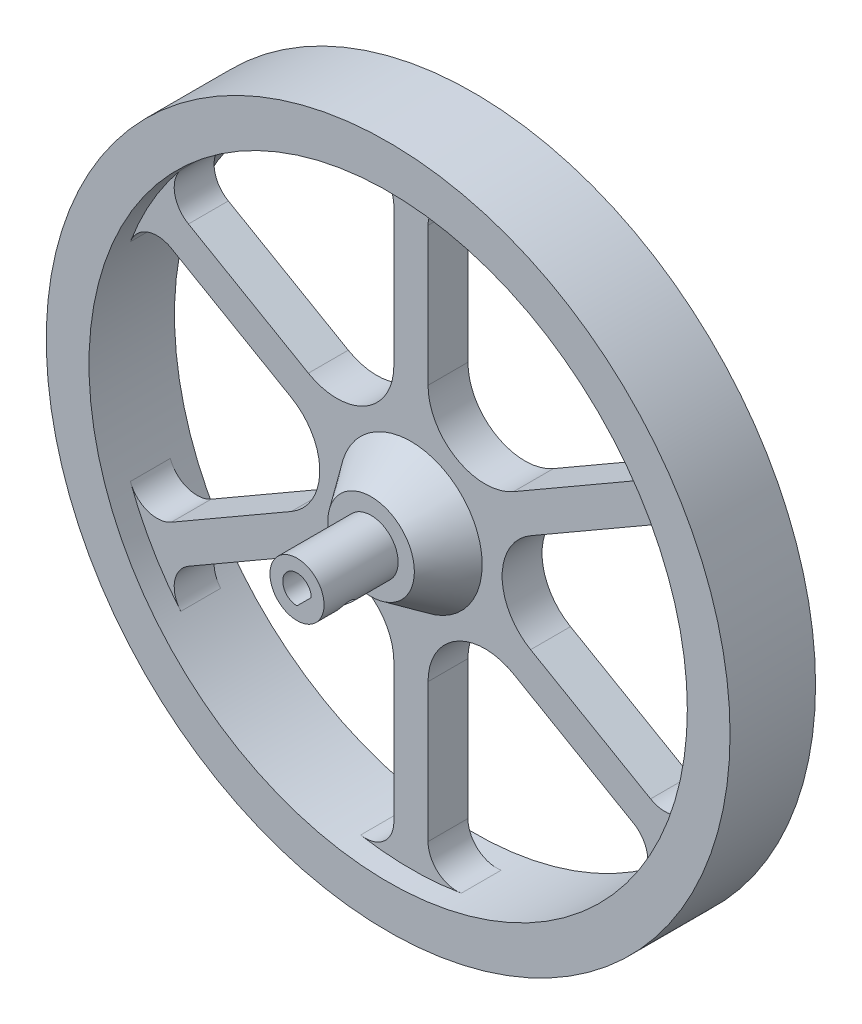
from build123d import *
from build123d.topology import SkipClean

# Parameters (mm, degrees)
CROQUIS1_R                 = 60
SALIENTE_EXTRUIR1_DEPTH    = 7.5
CROQUIS2_R                 = 52.5
CORTAR_EXTRUIR1_DEPTH      = 4
CROQUIS4_R                 = 4.75
SALIENTE_EXTRUIR2_DEPTH    = 20
CROQUIS6_R                 = 12.5
SALIENTE_EXTRUIR3_DEPTH    = 7
SALIENTE_EXTRUIR3_TAPER    = 35
CORTAR_EXTRUIR3_DEPTH      = 20
CORTAR_EXTRUIR4_REACH      = 91.752
CORTAR_EXTRUIR4_END_RADIUS = 4.75
CROQUIS7_R                 = 1.5
CORTAR_EXTRUIR5_START      = -7
CORTAR_EXTRUIR5_DEPTH      = 7
CORTAR_EXTRUIR6_DEPTH      = 3


# Read off the part's stored shape, not the designer's step: Cortar-Extruir5
with BuildPart() as part:
    # Croquis1 → Saliente-Extruir1 (new, symmetric)
    with BuildSketch(Plane.XY):
        Circle(CROQUIS1_R)
    extrude(amount=SALIENTE_EXTRUIR1_DEPTH, both=True)

    # Croquis2 → Cortar-Extruir1 (cut)
    with BuildSketch(Plane.XY.offset(7.5)):
        Circle(CROQUIS2_R)
    cortar_extruir1 = extrude(amount=-CORTAR_EXTRUIR1_DEPTH, mode=Mode.SUBTRACT)

    # Simetría1: Cortar-Extruir1 across plane
    add(cortar_extruir1.mirror(Plane.XY), mode=Mode.SUBTRACT)

    # Croquis4 → Saliente-Extruir2 (add)
    with BuildSketch(Plane.XY.offset(3.5)):
        Circle(CROQUIS4_R)
    extrude(amount=SALIENTE_EXTRUIR2_DEPTH)

    # Croquis6 → Saliente-Extruir3 (add)
    with BuildSketch(Plane.XY.offset(3.5)):
        Circle(CROQUIS6_R)
    extrude(amount=SALIENTE_EXTRUIR3_DEPTH, taper=SALIENTE_EXTRUIR3_TAPER)

    # Croquis5 → Cortar-Extruir3 (cut)
    with BuildSketch(Plane.XY.offset(23.5)):
        with BuildLine():
            Line((2.5, 0), (0, -2.5))
            ThreePointArc((0, -2.5), (-1.767766953, 1.767766953), (2.5, 0))
        make_face()
    extrude(amount=-CORTAR_EXTRUIR3_DEPTH, mode=Mode.SUBTRACT)

    # Cortar-Extruir4: up to this cylinder (the profile starts inside it)
    cortar_extruir4_end = Plane(origin=(0, 0, 18.5), z_dir=(0, 0, -1)) * Cylinder(CORTAR_EXTRUIR4_END_RADIUS, 194.004, mode=Mode.PRIVATE)
    # Croquis7 → Cortar-Extruir4 (cut, up to the surface)
    with BuildSketch(Plane(origin=(1.25, -1.25, 0), x_dir=(0, 0, 1), z_dir=(-0.7071067811865477, 0.7071067811865475, 0)), mode=Mode.PRIVATE) as cortar_extruir4_sk1:
        with Locations(Location((18.5, 0, 0), (0, 0, 270))):
            Circle(CROQUIS7_R)
    cortar_extruir4_tool1 = extrude(cortar_extruir4_sk1.sketch, amount=-CORTAR_EXTRUIR4_REACH, mode=Mode.PRIVATE) & cortar_extruir4_end
    add(cortar_extruir4_tool1.solids().sort_by_distance((1.25, -1.25, 18.5))[0], mode=Mode.SUBTRACT)

    # Cortar-Extruir5 outline → Cortar-Extruir5 (cut)
    with SkipClean():  # the faces are left unmerged after this step: merging them gives an invalid solid
        with BuildSketch(Plane.XY.offset(3.5).offset(CORTAR_EXTRUIR5_START)):
            with BuildLine():
                ThreePointArc((49.237906391, -18.217534801), (52.5, 0), (49.237906391, 18.217534801))
                ThreePointArc((49.237906391, 18.217534801), (46.246213297, 21.185514358), (42.048581973, 20.812658506))
                Line((42.048581973, 20.812658506), (21, 8.660254038))
                ThreePointArc((21, 8.660254038), (16, 0), (21, -8.660254038))
                Line((21, -8.660254038), (42.048581973, -20.812658506))
                ThreePointArc((42.048581973, -20.812658506), (46.246213297, -21.185514358), (49.237906391, -18.217534801))
            make_face()
            with BuildLine():
                ThreePointArc((39.048581973, 26.008810929), (41.470300275, 29.457638365), (40.395801128, 33.532510363))
                ThreePointArc((40.395801128, 33.532510363), (26.25, 45.466333699), (8.842105263, 51.750045164))
                ThreePointArc((8.842105263, 51.750045164), (4.775913022, 50.643152723), (3, 46.821469434))
                Line((3, 46.821469434), (3, 22.516660498))
                ThreePointArc((3, 22.516660498), (8, 13.856406461), (18, 13.856406461))
                Line((18, 13.856406461), (39.048581973, 26.008810929))
            make_face()
            with BuildLine():
                ThreePointArc((8.842105263, -51.750045164), (26.25, -45.466333699), (40.395801128, -33.532510363))
                ThreePointArc((40.395801128, -33.532510363), (41.470300275, -29.457638365), (39.048581973, -26.008810929))
                Line((39.048581973, -26.008810929), (18, -13.856406461))
                ThreePointArc((18, -13.856406461), (8, -13.856406461), (3, -22.516660498))
                Line((3, -22.516660498), (3, -46.821469434))
                ThreePointArc((3, -46.821469434), (4.775913022, -50.643152723), (8.842105263, -51.750045164))
            make_face()
            with BuildLine():
                ThreePointArc((-3, 46.821469434), (-4.775913022, 50.643152723), (-8.842105263, 51.750045164))
                ThreePointArc((-8.842105263, 51.750045164), (-26.25, 45.466333699), (-40.395801128, 33.532510363))
                ThreePointArc((-40.395801128, 33.532510363), (-41.470300275, 29.457638365), (-39.048581973, 26.008810929))
                Line((-39.048581973, 26.008810929), (-18, 13.856406461))
                ThreePointArc((-18, 13.856406461), (-8, 13.856406461), (-3, 22.516660498))
                Line((-3, 22.516660498), (-3, 46.821469434))
            make_face()
            with BuildLine():
                ThreePointArc((-40.395801128, -33.532510363), (-26.25, -45.466333699), (-8.842105263, -51.750045164))
                ThreePointArc((-8.842105263, -51.750045164), (-4.775913022, -50.643152723), (-3, -46.821469434))
                Line((-3, -46.821469434), (-3, -22.516660498))
                ThreePointArc((-3, -22.516660498), (-8, -13.856406461), (-18, -13.856406461))
                Line((-18, -13.856406461), (-39.048581973, -26.008810929))
                ThreePointArc((-39.048581973, -26.008810929), (-41.470300275, -29.457638365), (-40.395801128, -33.532510363))
            make_face()
            with BuildLine():
                ThreePointArc((-42.048581973, 20.812658506), (-46.246213297, 21.185514358), (-49.237906391, 18.217534801))
                ThreePointArc((-49.237906391, 18.217534801), (-52.5, 0), (-49.237906391, -18.217534801))
                ThreePointArc((-49.237906391, -18.217534801), (-46.246213297, -21.185514358), (-42.048581973, -20.812658506))
                Line((-42.048581973, -20.812658506), (-21, -8.660254038))
                ThreePointArc((-21, -8.660254038), (-16, 0), (-21, 8.660254038))
                Line((-21, 8.660254038), (-42.048581973, 20.812658506))
            make_face()
        extrude(amount=CORTAR_EXTRUIR5_DEPTH, mode=Mode.SUBTRACT)
    add(part.part.scale(1), mode=Mode.REPLACE)  # the faces are merged on a copy

    # Croquis10 → Cortar-Extruir6 (cut)
    # profile 1 of 3: a face of its own
    with BuildSketch(Plane(origin=(0, 0, -3.5), x_dir=(-1, 0, 0), z_dir=(0, 0, -1))):
        with BuildLine():
            add(Edge.make_bspline(
                [(-8.618636529, -3.958585729), (-8.626034443, -3.969769874), (-8.63979748, -3.990576788), (-8.636380298, -4.031184404), (-8.605950842, -4.063150051), (-8.558290764, -4.089833553), (-8.491226427, -4.116129017), (-8.402473137, -4.138086281), (-8.293065323, -4.160143533), (-8.162351503, -4.178091981), (-8.011060276, -4.196215959), (-7.838518307, -4.20980545), (-7.64473259, -4.223491848), (-7.429842437, -4.233399867), (-7.193977464, -4.240148474), (-6.937171289, -4.24652816), (-6.658847945, -4.248847202), (-6.465989654, -4.249648627), (-6.365900736, -4.250064548)],
                knots=[0, 0, 0, 0, 0.264522454, 0.492115977, 0.758469058, 1.116905389, 1.594696211, 2.206856012, 2.960861016, 3.847548454, 4.869807865, 6.037241621, 7.341541194, 8.792334255, 10.380264796, 12.105895113, 13.979051144, 16, 16, 16, 16], degree=3))
            add(Edge.make_bspline(
                [(-6.365900736, -4.250064548), (-6.308104413, -4.247595857), (-6.19996694, -4.242976912), (-6.049776099, -4.207848597), (-5.926348063, -4.143646756), (-5.843800989, -4.065651364), (-5.789760291, -3.983293619), (-5.750141813, -3.898164226), (-5.706113822, -3.792822966), (-5.660719786, -3.664843627), (-5.616516764, -3.514331476), (-5.569667616, -3.34182126), (-5.51939755, -3.147813608), (-5.488598777, -3.010038424), (-5.472422951, -2.937677506)],
                knots=[0, 0, 0, 0, 1.181004775, 2.209671203, 3.12485452, 3.993073648, 4.496817558, 5.130576657, 5.908980013, 6.830669454, 7.904106987, 9.114595617, 10.484556503, 12, 12, 12, 12], degree=3))
            Line((-5.472422951, -2.937677506), (-5.097455225, -2.937677506))
            Line((-5.097455225, -2.937677506), (-5.273221347, -5))
            Line((-5.273221347, -5), (-9.784551802, -5))
            Line((-9.784551802, -5), (-9.784551802, -4.746603841))
            Line((-9.784551802, -4.746603841), (-8.300792792, -3.113443628))
            add(Edge.make_bspline(
                [(-8.300792792, -3.113443628), (-8.202601232, -3.009989162), (-8.016196217, -2.813593144), (-7.752161322, -2.533705689), (-7.519320432, -2.284109648), (-7.318987486, -2.063212191), (-7.146386785, -1.875714908), (-7.008201899, -1.714852876), (-6.896576198, -1.587674969), (-6.836735593, -1.509346824), (-6.811174911, -1.475889261)],
                knots=[0, 0, 0, 0, 1.545890058, 2.934688704, 4.17028174, 5.24526459, 6.166829156, 6.931941195, 7.543782827, 8, 8, 8, 8], degree=3))
            add(Edge.make_bspline(
                [(-6.811174911, -1.475889261), (-6.754997292, -1.397475865), (-6.645845913, -1.245121055), (-6.503438896, -1.011924417), (-6.385002919, -0.782476269), (-6.291593836, -0.557215903), (-6.21963523, -0.339145391), (-6.167905745, -0.13064431), (-6.135070067, 0.067857618), (-6.130721514, 0.197192775), (-6.128616472, 0.25980119)],
                knots=[0, 0, 0, 0, 1.221342228, 2.373030247, 3.457097868, 4.48831189, 5.458191672, 6.362523757, 7.207332364, 8, 8, 8, 8], degree=3))
            add(Edge.make_bspline(
                [(-6.128616472, 0.25980119), (-6.12994016, 0.309145796), (-6.132514799, 0.405123517), (-6.146767524, 0.545367205), (-6.172630682, 0.677514679), (-6.211492788, 0.800599348), (-6.257885143, 0.916619927), (-6.317251131, 1.02369836), (-6.38587227, 1.123781877), (-6.465590562, 1.215080622), (-6.554391837, 1.296769797), (-6.652261062, 1.367937753), (-6.75814723, 1.427734861), (-6.871626773, 1.478306947), (-6.994063966, 1.516339364), (-7.124747398, 1.541906761), (-7.263348981, 1.558544639), (-7.358441029, 1.560784168), (-7.407315007, 1.561935207)],
                knots=[0, 0, 0, 0, 1.144811332, 2.226715166, 3.266231702, 4.262137236, 5.217010938, 6.159784736, 7.096004777, 8.02721036, 8.965073134, 9.889365439, 10.827775152, 11.781102716, 12.766194483, 13.794607472, 14.866505594, 16, 16, 16, 16], degree=3))
            add(Edge.make_bspline(
                [(-7.407315007, 1.561935207), (-7.462532456, 1.561390595), (-7.570778448, 1.560322959), (-7.728751599, 1.543199133), (-7.878901161, 1.518378731), (-8.021963245, 1.485613944), (-8.156283293, 1.439606465), (-8.283502646, 1.385493666), (-8.402725567, 1.320814967), (-8.512315011, 1.246778562), (-8.612048882, 1.167729006), (-8.699502323, 1.086636743), (-8.773834513, 1.003973097), (-8.834666543, 0.920205583), (-8.881621631, 0.835001961), (-8.916971551, 0.748858063), (-8.935704611, 0.660466191), (-8.939162374, 0.601153561), (-8.940874418, 0.571786056)],
                knots=[0, 0, 0, 0, 1.326433612, 2.60028531, 3.813684945, 4.983463278, 6.122649585, 7.221225408, 8.302875734, 9.376861028, 10.395780236, 11.358844163, 12.239770449, 13.063676203, 13.84097391, 14.573117523, 15.293506644, 16, 16, 16, 16], degree=3))
            add(Edge.make_bspline(
                [(-8.940874418, 0.571786056), (-8.939506439, 0.534958047), (-8.937007758, 0.467689892), (-8.899333875, 0.41229768), (-8.882285711, 0.387231628)],
                knots=[0, 0, 0, 0, 1.094961168, 2, 2, 2, 2], degree=3))
            add(Edge.make_bspline(
                [(-8.882285711, 0.387231628), (-8.870945509, 0.376477988), (-8.845270659, 0.352131148), (-8.792658261, 0.324307194), (-8.725508445, 0.298261003), (-8.675402129, 0.282880738), (-8.647930882, 0.274448367)],
                knots=[0, 0, 0, 0, 0.710690112, 1.609041988, 2.689135369, 4, 4, 4, 4], degree=3))
            add(Edge.make_bspline(
                [(-8.647930882, 0.274448367), (-8.611921151, 0.264281261), (-8.54245406, 0.244667695), (-8.448231847, 0.199291045), (-8.368856918, 0.142416004), (-8.302431238, 0.075937268), (-8.252735237, -0.003611878), (-8.21505907, -0.092320949), (-8.19512868, -0.192910451), (-8.19237843, -0.263023964), (-8.190938966, -0.299720964)],
                knots=[0, 0, 0, 0, 1.118595343, 2.15790461, 3.111021168, 4.030836712, 4.951116574, 5.901090488, 6.901443123, 8, 8, 8, 8], degree=3))
            add(Edge.make_bspline(
                [(-8.190938966, -0.299720964), (-8.192728697, -0.339506769), (-8.196211743, -0.416935051), (-8.228629236, -0.527134954), (-8.278641104, -0.628283369), (-8.351033461, -0.714659827), (-8.436985817, -0.788486093), (-8.539295003, -0.837552074), (-8.651298462, -0.870249609), (-8.730194856, -0.873615551), (-8.770967167, -0.875355012)],
                knots=[0, 0, 0, 0, 1.041125866, 2.026164562, 2.988296164, 3.980302212, 4.962423256, 5.935991559, 6.933355608, 8, 8, 8, 8], degree=3))
            add(Edge.make_bspline(
                [(-8.770967167, -0.875355012), (-8.818301015, -0.871871804), (-8.913336446, -0.864878327), (-9.049774545, -0.81038197), (-9.175690901, -0.721736715), (-9.28962821, -0.602057999), (-9.38687557, -0.455065452), (-9.452935144, -0.282419314), (-9.497615301, -0.091555703), (-9.50137215, 0.04323017), (-9.503326007, 0.113329422)],
                knots=[0, 0, 0, 0, 0.83205251, 1.670569209, 2.548472486, 3.527734868, 4.565379759, 5.630600578, 6.767725999, 8, 8, 8, 8], degree=3))
            add(Edge.make_bspline(
                [(-9.503326007, 0.113329422), (-9.500257972, 0.194113961), (-9.494195313, 0.353750048), (-9.445066196, 0.587225746), (-9.36095501, 0.807792403), (-9.248338157, 1.017733248), (-9.100199899, 1.212429926), (-8.918156943, 1.389017025), (-8.702696627, 1.546434694), (-8.4593366, 1.683484438), (-8.194013277, 1.795639347), (-7.915144112, 1.87805181), (-7.625387245, 1.927852209), (-7.428991489, 1.933863403), (-7.32968497, 1.936902934)],
                knots=[0, 0, 0, 0, 0.920453742, 1.818883095, 2.704880925, 3.603999707, 4.525765236, 5.482253031, 6.485303894, 7.559571233, 8.659544837, 9.762092633, 10.86841348, 12, 12, 12, 12], degree=3))
            add(Edge.make_bspline(
                [(-7.32968497, 1.936902934), (-7.231338984, 1.933922927), (-7.037333978, 1.928044333), (-6.752216064, 1.877753341), (-6.478110886, 1.79757811), (-6.219365606, 1.684548515), (-5.980211424, 1.5488039), (-5.768465096, 1.390768229), (-5.590152156, 1.209627257), (-5.445260796, 1.010003867), (-5.331471768, 0.796383909), (-5.25039548, 0.571530012), (-5.20023069, 0.336713611), (-5.194226518, 0.176558111), (-5.191197157, 0.09575281)],
                knots=[0, 0, 0, 0, 1.125553274, 2.220354679, 3.304870239, 4.389270482, 5.446207922, 6.448192551, 7.405024832, 8.34559417, 9.263572082, 10.167392221, 11.075370971, 12, 12, 12, 12], degree=3))
            add(Edge.make_bspline(
                [(-5.191197157, 0.09575281), (-5.193185155, 0.038565599), (-5.197193835, -0.076749004), (-5.220639688, -0.250096242), (-5.262852133, -0.424245309), (-5.319609421, -0.598585115), (-5.390617441, -0.771015313), (-5.478615126, -0.938158417), (-5.579981416, -1.100205956), (-5.658556833, -1.202111457), (-5.697989474, -1.253252174)],
                knots=[0, 0, 0, 0, 0.935020729, 1.885413617, 2.853338986, 3.860387131, 4.880132302, 5.897532329, 6.944888138, 8, 8, 8, 8], degree=3))
            add(Edge.make_bspline(
                [(-5.697989474, -1.253252174), (-5.768879821, -1.338974448), (-5.907813362, -1.506976151), (-6.127745265, -1.741751129), (-6.349106096, -1.958940673), (-6.502890385, -2.091831711), (-6.5782848, -2.156982983)],
                knots=[0, 0, 0, 0, 1.056246566, 2.070071318, 3.053831537, 4, 4, 4, 4], degree=3))
            Line((-6.5782848, -2.156982983), (-7.892136559, -3.252591807))
            add(Edge.make_bspline(
                [(-7.892136559, -3.252591807), (-7.969789271, -3.318413711), (-8.116500011, -3.442772279), (-8.315304125, -3.62653699), (-8.481834124, -3.794678052), (-8.575355244, -3.90672893), (-8.618636529, -3.958585729)],
                knots=[0, 0, 0, 0, 1.203835763, 2.274429704, 3.201411408, 4, 4, 4, 4], degree=3))
        make_face()
    # profile 2 of 3: a face of its own
    with BuildSketch(Plane(origin=(0, 0, -3.5), x_dir=(-1, 0, 0), z_dir=(0, 0, -1))):
        with BuildLine():
            Line((1.058753185, 1.687900928), (1.558221914, 2.405612591))
            Line((1.558221914, 2.405612591), (1.93318964, 2.405612591))
            Line((1.93318964, 2.405612591), (2.026931571, -0.500387286))
            Line((2.026931571, -0.500387286), (1.651963845, -0.500387286))
            add(Edge.make_bspline(
                [(1.651963845, -0.500387286), (1.621474871, -0.3990797), (1.562370376, -0.202689566), (1.464058061, 0.078731831), (1.361657042, 0.338799674), (1.255233316, 0.57686021), (1.145730838, 0.794345483), (1.029239543, 0.988527094), (0.91286732, 1.164595933), (0.82538362, 1.267788708), (0.783386261, 1.317327355)],
                knots=[0, 0, 0, 0, 1.251020926, 2.425170469, 3.524171439, 4.555392157, 5.508244528, 6.40142918, 7.232591291, 8, 8, 8, 8], degree=3))
            add(Edge.make_bspline(
                [(0.783386261, 1.317327355), (0.730133647, 1.37394184), (0.626348199, 1.48427933), (0.458037458, 1.630447359), (0.283807782, 1.754484867), (0.101900296, 1.854309278), (-0.084073404, 1.934459547), (-0.276784492, 1.990840793), (-0.475656877, 2.023253141), (-0.61042167, 2.028166424), (-0.678401984, 2.030644865)],
                knots=[0, 0, 0, 0, 1.110969946, 2.165199143, 3.18223948, 4.163564161, 5.127141723, 6.07281956, 7.027859374, 8, 8, 8, 8], degree=3))
            add(Edge.make_bspline(
                [(-0.678401984, 2.030644865), (-0.730685091, 2.029439553), (-0.833547661, 2.027068203), (-0.985875, 2.01062277), (-1.133920048, 1.983171854), (-1.277989934, 1.94267212), (-1.418720025, 1.893987807), (-1.554071802, 1.830958837), (-1.686469239, 1.759785484), (-1.81343735, 1.675927774), (-1.935717589, 1.582417487), (-2.050272197, 1.476356663), (-2.15702304, 1.35882339), (-2.25686421, 1.231009626), (-2.349776137, 1.091942457), (-2.435883954, 0.941921366), (-2.513159298, 0.779964421), (-2.584242401, 0.607098244), (-2.647941428, 0.419541735), (-2.701312785, 0.21431514), (-2.746726714, -0.009138767), (-2.782470565, -0.250788214), (-2.811437629, -0.510219287), (-2.834060078, -0.78760925), (-2.844742791, -1.083259381), (-2.846661941, -1.286446354), (-2.847648868, -1.390935636)],
                knots=[0, 0, 0, 0, 0.823796013, 1.620748659, 2.411437733, 3.193508172, 3.977053112, 4.755139854, 5.543542341, 6.343756339, 7.150123229, 7.966811042, 8.800037687, 9.649585728, 10.520193315, 11.433440101, 12.372853853, 13.345819764, 14.377400787, 15.491493967, 16.685002667, 17.968944224, 19.339386818, 20.798059807, 22.353396251, 24, 24, 24, 24], degree=3))
            add(Edge.make_bspline(
                [(-2.847648868, -1.390935636), (-2.846895716, -1.492019449), (-2.845428759, -1.688906262), (-2.8314621, -1.976078487), (-2.81204509, -2.246350214), (-2.782662401, -2.499480405), (-2.745079229, -2.735660547), (-2.698099428, -2.95502392), (-2.644951573, -3.157971097), (-2.580863529, -3.34387322), (-2.51113144, -3.515893756), (-2.432423704, -3.6746746), (-2.349960868, -3.822600099), (-2.259746592, -3.958630192), (-2.163354767, -4.083049999), (-2.060596648, -4.196274666), (-1.951826853, -4.298299572), (-1.835863908, -4.387746245), (-1.713752817, -4.465147611), (-1.587191039, -4.5332857), (-1.455219472, -4.590111893), (-1.318211184, -4.637477898), (-1.176080919, -4.673689226), (-1.028858859, -4.700708685), (-0.876407611, -4.714665142), (-0.77314397, -4.717393362), (-0.720878797, -4.718774205)],
                knots=[0, 0, 0, 0, 1.631186038, 3.177155776, 4.63899391, 6.003364438, 7.28836664, 8.496856833, 9.62260426, 10.671616769, 11.668059891, 12.615969282, 13.529764093, 14.399525857, 15.24745698, 16.067396316, 16.864608443, 17.651039786, 18.42698067, 19.195444562, 19.968298906, 20.743239014, 21.532507192, 22.33309974, 23.156326176, 24, 24, 24, 24], degree=3))
            add(Edge.make_bspline(
                [(-0.720878797, -4.718774205), (-0.650524438, -4.717397049), (-0.513846943, -4.714721645), (-0.315142056, -4.693232101), (-0.129364472, -4.654000582), (0.045579749, -4.604308536), (0.207473454, -4.536330374), (0.35672818, -4.453745764), (0.493947978, -4.356594635), (0.618029705, -4.244922446), (0.730093201, -4.122480963), (0.824423812, -3.987787813), (0.908210099, -3.847278755), (0.973303146, -3.696090739), (1.027213879, -3.537759577), (1.062742031, -3.3700583), (1.085669736, -3.194153614), (1.088210223, -3.07397251), (1.089512256, -3.012378108)],
                knots=[0, 0, 0, 0, 1.200900719, 2.332991246, 3.405271255, 4.43909341, 5.432830909, 6.395355971, 7.345825392, 8.296148631, 9.240275041, 10.17233142, 11.098631309, 12.027813901, 12.976637487, 13.94935664, 14.949018214, 16, 16, 16, 16], degree=3))
            Line((1.089512256, -3.012378108), (1.089512256, -2.33567854))
            add(Edge.make_bspline(
                [(1.089512256, -2.33567854), (1.088313492, -2.310577945), (1.085975413, -2.261621549), (1.061712412, -2.193065685), (1.022186907, -2.133418802), (0.966117797, -2.084257687), (0.892617661, -2.045380269), (0.800604317, -2.018616991), (0.689173673, -2.003338587), (0.608649722, -2.001338708), (0.565143327, -2.000258191)],
                knots=[0, 0, 0, 0, 0.852785987, 1.663280422, 2.443303987, 3.26836038, 4.176809956, 5.255944748, 6.51741062, 8, 8, 8, 8], degree=3))
            Line((0.565143327, -2.000258191), (-0.035390922, -2.000258191))
            Line((-0.035390922, -2.000258191), (-0.035390922, -1.625290465))
            Line((-0.035390922, -1.625290465), (3.058092818, -1.625290465))
            Line((3.058092818, -1.625290465), (3.058092818, -2.000258191))
            Line((3.058092818, -2.000258191), (2.639183562, -2.000258191))
            add(Edge.make_bspline(
                [(2.639183562, -2.000258191), (2.595669746, -2.00120167), (2.515058036, -2.002949515), (2.403957334, -2.019813271), (2.31248508, -2.048548273), (2.238815283, -2.089179598), (2.186568225, -2.145086136), (2.14573202, -2.208278028), (2.124711651, -2.284623788), (2.12205215, -2.338505904), (2.120673503, -2.366437611)],
                knots=[0, 0, 0, 0, 1.440436752, 2.668487384, 3.706415582, 4.604887793, 5.416694109, 6.215352239, 7.074864511, 8, 8, 8, 8], degree=3))
            Line((2.120673503, -2.366437611), (2.120673503, -5.093741932))
            Line((2.120673503, -5.093741932), (1.76914126, -5.093741932))
            add(Edge.make_bspline(
                [(1.76914126, -5.093741932), (1.705528594, -4.889218189), (1.580368521, -4.4868108), (1.439841934, -4.089510426), (1.370738051, -3.894138151)],
                knots=[0, 0, 0, 0, 1.016500928, 2, 2, 2, 2], degree=3))
            add(Edge.make_bspline(
                [(1.370738051, -3.894138151), (1.308488576, -3.989494436), (1.187527847, -4.174787017), (0.973923927, -4.419357776), (0.744995314, -4.62855898), (0.496275988, -4.798631033), (0.230875747, -4.931887933), (-0.052171438, -5.026136287), (-0.352418411, -5.083041193), (-0.558532179, -5.090125394), (-0.663754807, -5.093741932)],
                knots=[0, 0, 0, 0, 1.102150784, 2.141656039, 3.136336827, 4.099380808, 5.051336214, 6.004196136, 6.981127121, 8, 8, 8, 8], degree=3))
            add(Edge.make_bspline(
                [(-0.663754807, -5.093741932), (-0.739974987, -5.092376896), (-0.890783427, -5.089676051), (-1.114891714, -5.066782658), (-1.334621317, -5.030424549), (-1.550541924, -4.979224469), (-1.761902808, -4.912237714), (-1.970394143, -4.834494038), (-2.173085386, -4.737538372), (-2.371429325, -4.629139711), (-2.561574869, -4.505269398), (-2.744149075, -4.371589632), (-2.91336323, -4.221880938), (-3.076004855, -4.064531927), (-3.225099005, -3.89205696), (-3.364369505, -3.708180278), (-3.495260026, -3.513774755), (-3.613399889, -3.306851095), (-3.720140852, -3.09137283), (-3.812299626, -2.867488667), (-3.892442236, -2.637631243), (-3.954348771, -2.399718468), (-4.004386434, -2.155775131), (-4.041639283, -1.905045013), (-4.061691243, -1.64661748), (-4.06474688, -1.472015), (-4.066293978, -1.383612048)],
                knots=[0, 0, 0, 0, 0.976077124, 1.931255848, 2.88224913, 3.827239923, 4.770718944, 5.720786486, 6.674736104, 7.645993263, 8.613922773, 9.57950598, 10.541376055, 11.505418933, 12.476112203, 13.457961968, 14.458748306, 15.475661141, 16.50767213, 17.536647004, 18.574929607, 19.62310905, 20.682773345, 21.763523009, 22.867649709, 24, 24, 24, 24], degree=3))
            add(Edge.make_bspline(
                [(-4.066293978, -1.383612048), (-4.064760042, -1.294720469), (-4.061738616, -1.119628796), (-4.04157499, -0.860232629), (-4.00418316, -0.60808131), (-3.954746895, -0.362544051), (-3.892453397, -0.123719794), (-3.811954567, 0.106465118), (-3.720556583, 0.331161781), (-3.613023607, 0.547235214), (-3.494956171, 0.755595748), (-3.364293218, 0.952532661), (-3.225375059, 1.140079491), (-3.073538096, 1.314339619), (-2.912220747, 1.478785176), (-2.740874364, 1.632869816), (-2.558806487, 1.775248833), (-2.367609484, 1.904825933), (-2.170767452, 2.02135211), (-1.971953971, 2.124132354), (-1.772394863, 2.211061794), (-1.572470957, 2.281230965), (-1.372626555, 2.337923145), (-1.17176927, 2.377102538), (-0.970012405, 2.401739045), (-0.835196596, 2.404320912), (-0.767749762, 2.405612591)],
                knots=[0, 0, 0, 0, 1.150411752, 2.265991001, 3.364203212, 4.447241947, 5.506293626, 6.55534581, 7.600833571, 8.643549088, 9.676493501, 10.698187216, 11.700311583, 12.694757335, 13.686670589, 14.679991584, 15.674738395, 16.675427509, 17.666958318, 18.63342948, 19.570133314, 20.481408954, 21.373646862, 22.255940457, 23.127466615, 24, 24, 24, 24], degree=3))
            add(Edge.make_bspline(
                [(-0.767749762, 2.405612591), (-0.69151028, 2.403411119), (-0.540483327, 2.399050101), (-0.316725973, 2.371215182), (-0.099194913, 2.322406111), (0.11670804, 2.253468871), (0.337858918, 2.159736286), (0.56702272, 2.031305288), (0.811429143, 1.874147162), (0.973617687, 1.752011824), (1.058753185, 1.687900928)],
                knots=[0, 0, 0, 0, 0.913388859, 1.809381844, 2.696317573, 3.58052964, 4.521373867, 5.568440857, 6.723633652, 8, 8, 8, 8], degree=3))
        make_face()
    # profile 3 of 3: a face of its own
    with BuildSketch(Plane(origin=(0, 0, -3.5), x_dir=(-1, 0, 0), z_dir=(0, 0, -1))):
        with BuildLine():
            Line((3.620544408, 2.31187066), (7.384868846, 2.31187066))
            add(Edge.make_bspline(
                [(7.384868846, 2.31187066), (7.453253032, 2.311195984), (7.587744598, 2.309869095), (7.785674655, 2.29438361), (7.975906355, 2.271526605), (8.158225364, 2.238992819), (8.33276127, 2.198908182), (8.498679022, 2.146679416), (8.657950467, 2.087706156), (8.758642561, 2.038789894), (8.808574431, 2.014532971)],
                knots=[0, 0, 0, 0, 1.117997266, 2.198771569, 3.244505109, 4.249964674, 5.225989755, 6.17045059, 7.0927508, 8, 8, 8, 8], degree=3))
            add(Edge.make_bspline(
                [(8.808574431, 2.014532971), (8.868703767, 1.981805808), (8.989992751, 1.915790703), (9.162789376, 1.798355581), (9.326855187, 1.662951369), (9.488022483, 1.51627567), (9.637168112, 1.348945326), (9.78417172, 1.17025485), (9.920648733, 0.973429733), (10.050865111, 0.763089635), (10.171098107, 0.541080857), (10.273674169, 0.306017605), (10.361503914, 0.061905667), (10.433411905, -0.192585556), (10.489171414, -0.456852338), (10.527713727, -0.731425154), (10.554243233, -1.015936148), (10.556367998, -1.20924784), (10.557447341, -1.307446728)],
                knots=[0, 0, 0, 0, 0.833082016, 1.680438849, 2.538176053, 3.421420561, 4.330214496, 5.264067045, 6.236958324, 7.243141623, 8.2749117, 9.307503224, 10.362232928, 11.430954548, 12.524413756, 13.647423916, 14.804933345, 16, 16, 16, 16], degree=3))
            add(Edge.make_bspline(
                [(10.557447341, -1.307446728), (10.55677402, -1.389008786), (10.555446399, -1.549828732), (10.53979727, -1.787745994), (10.517076962, -2.0194888), (10.483382285, -2.245345434), (10.439173794, -2.465155857), (10.38654733, -2.678745181), (10.325719512, -2.886465235), (10.276028852, -3.020455312), (10.251321346, -3.08707871)],
                knots=[0, 0, 0, 0, 1.077752757, 2.125058456, 3.149778305, 4.154495193, 5.141548337, 6.111839545, 7.061156861, 8, 8, 8, 8], degree=3))
            add(Edge.make_bspline(
                [(10.251321346, -3.08707871), (10.209528265, -3.186239012), (10.126400019, -3.383473146), (9.963264305, -3.661420076), (9.76671217, -3.917765509), (9.543054115, -4.15629051), (9.288813218, -4.368448303), (9.008081851, -4.554354673), (8.701286856, -4.712611711), (8.481974369, -4.791502572), (8.370623845, -4.831557467)],
                knots=[0, 0, 0, 0, 0.97266033, 1.934663506, 2.905446935, 3.889590833, 4.886544553, 5.89344674, 6.930449359, 8, 8, 8, 8], degree=3))
            add(Edge.make_bspline(
                [(8.370623845, -4.831557467), (8.325867879, -4.845346575), (8.233214082, -4.873892786), (8.086991756, -4.905913874), (7.930911233, -4.936230296), (7.763567397, -4.958692847), (7.58535852, -4.978085185), (7.396261115, -4.990978388), (7.196951572, -4.998024132), (7.060683578, -4.999330577), (6.99085979, -5)],
                knots=[0, 0, 0, 0, 0.805217408, 1.666961051, 2.572873821, 3.539648437, 4.570025201, 5.656022224, 6.798944616, 8, 8, 8, 8], degree=3))
            Line((6.99085979, -5), (3.620544408, -5))
            Line((3.620544408, -5), (3.620544408, -4.625032274))
            Line((3.620544408, -4.625032274), (4.292849823, -4.625032274))
            add(Edge.make_bspline(
                [(4.292849823, -4.625032274), (4.331948838, -4.62379066), (4.404114691, -4.621498989), (4.503500816, -4.608256003), (4.584150605, -4.582999214), (4.646919552, -4.544880539), (4.692835584, -4.494321684), (4.723230725, -4.432251513), (4.743292245, -4.359684623), (4.744696675, -4.307344003), (4.745447586, -4.279358901)],
                knots=[0, 0, 0, 0, 1.425691273, 2.631427591, 3.644559092, 4.484131817, 5.277931106, 6.097840766, 6.982967324, 8, 8, 8, 8], degree=3))
            Line((4.745447586, -4.279358901), (4.745447586, 1.601482585))
            add(Edge.make_bspline(
                [(4.745447586, 1.601482585), (4.744616557, 1.625571365), (4.742988906, 1.672751572), (4.721819843, 1.738680475), (4.688315406, 1.797643741), (4.640701842, 1.8463835), (4.583384117, 1.889338687), (4.512704512, 1.915497659), (4.433478215, 1.934344019), (4.376963301, 1.93601717), (4.347044377, 1.936902934)],
                knots=[0, 0, 0, 0, 0.980641448, 1.920681157, 2.796522487, 3.727845141, 4.685496402, 5.696699711, 6.780635719, 8, 8, 8, 8], degree=3))
            Line((4.347044377, 1.936902934), (3.620544408, 1.936902934))
            Line((3.620544408, 1.936902934), (3.620544408, 2.31187066))
        make_face()
        with BuildLine():
            add(Edge.make_bspline(
                [(6.213094702, 1.936902934), (6.178333846, 1.935970774), (6.113183828, 1.934223687), (6.022232857, 1.916492104), (5.944808423, 1.888413908), (5.882094844, 1.845879209), (5.833818752, 1.791522077), (5.799303647, 1.725255665), (5.781004135, 1.646862571), (5.778129565, 1.591319258), (5.776608833, 1.561935207)],
                knots=[0, 0, 0, 0, 1.263472642, 2.368044857, 3.357919552, 4.240039874, 5.095822289, 5.977942611, 6.930271981, 8, 8, 8, 8], degree=3))
            Line((5.776608833, 1.561935207), (5.776608833, -4.264711725))
            add(Edge.make_bspline(
                [(5.776608833, -4.264711725), (5.777677476, -4.292745238), (5.779708814, -4.346032971), (5.804512094, -4.420954995), (5.844483462, -4.484981949), (5.901297187, -4.53894608), (5.978212768, -4.57884948), (6.07499564, -4.604802354), (6.191949155, -4.622579389), (6.2769725, -4.6241714), (6.322948528, -4.625032274)],
                knots=[0, 0, 0, 0, 0.89930401, 1.709449408, 2.507459987, 3.307943107, 4.201045422, 5.265394816, 6.521273367, 8, 8, 8, 8], degree=3))
            Line((6.322948528, -4.625032274), (6.948382977, -4.625032274))
            add(Edge.make_bspline(
                [(6.948382977, -4.625032274), (7.017258937, -4.623378912), (7.153315318, -4.620112889), (7.354188366, -4.601620115), (7.54841422, -4.567388669), (7.735975536, -4.520730847), (7.917524718, -4.460776764), (8.091145723, -4.385280413), (8.260213919, -4.299541517), (8.365841542, -4.230559599), (8.418959528, -4.195869994)],
                knots=[0, 0, 0, 0, 1.062848101, 2.099531771, 3.108895551, 4.10282061, 5.079524816, 6.054833563, 7.021815301, 8, 8, 8, 8], degree=3))
            add(Edge.make_bspline(
                [(8.418959528, -4.195869994), (8.485838499, -4.145274168), (8.619887449, -4.043862362), (8.78761288, -3.851118312), (8.936323305, -3.635225964), (9.008789116, -3.473172854), (9.045858695, -3.390275269)],
                knots=[0, 0, 0, 0, 0.97036836, 1.94495903, 2.948752459, 4, 4, 4, 4], degree=3))
            add(Edge.make_bspline(
                [(9.045858695, -3.390275269), (9.069677827, -3.32955371), (9.119003302, -3.203809421), (9.178037709, -3.002872491), (9.227337014, -2.785525474), (9.26828805, -2.551842273), (9.299947461, -2.301559969), (9.323597183, -2.034335957), (9.336322851, -1.750406193), (9.337960981, -1.555484051), (9.338802231, -1.455383214)],
                knots=[0, 0, 0, 0, 0.794791685, 1.645881885, 2.549653267, 3.510508143, 4.536608563, 5.623965425, 6.779804852, 8, 8, 8, 8], degree=3))
            add(Edge.make_bspline(
                [(9.338802231, -1.455383214), (9.336746724, -1.308386103), (9.332767954, -1.023849169), (9.304827251, -0.612315253), (9.25242084, -0.231649222), (9.186124263, 0.119618409), (9.095037733, 0.439934669), (8.985232278, 0.730370787), (8.857460886, 0.992453529), (8.749532628, 1.146190891), (8.697255887, 1.220655988)],
                knots=[0, 0, 0, 0, 1.261482698, 2.441805943, 3.536837969, 4.55738863, 5.506995227, 6.390187172, 7.220261963, 8, 8, 8, 8], degree=3))
            add(Edge.make_bspline(
                [(8.697255887, 1.220655988), (8.650450496, 1.278226312), (8.557767702, 1.392225541), (8.392217825, 1.537700583), (8.210812316, 1.661812297), (8.011616394, 1.763654806), (7.794685284, 1.840732966), (7.560983965, 1.896402397), (7.310179547, 1.930277229), (7.13695096, 1.934654727), (7.047983779, 1.936902934)],
                knots=[0, 0, 0, 0, 0.952473484, 1.886062724, 2.820980377, 3.772626199, 4.753467373, 5.773493743, 6.856505225, 8, 8, 8, 8], degree=3))
            Line((7.047983779, 1.936902934), (6.213094702, 1.936902934))
        make_face(mode=Mode.SUBTRACT)
    extrude(amount=-CORTAR_EXTRUIR6_DEPTH, mode=Mode.SUBTRACT)


solid = part.part
